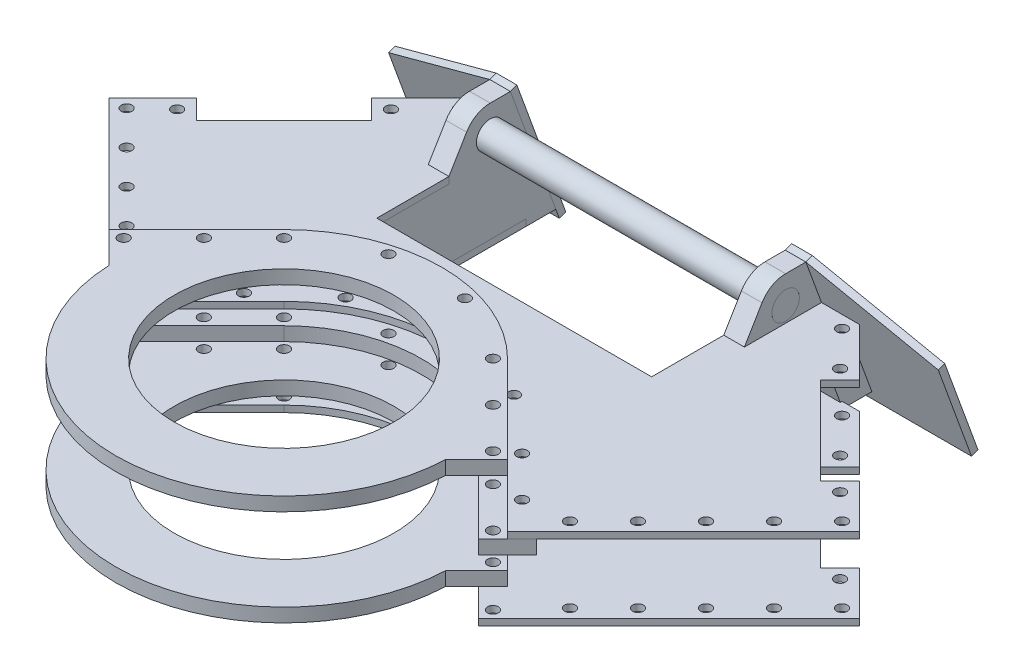
from build123d import *

# Parameters (mm, degrees)
BOSS_EXTRUDE1_DEPTH = 3.0226
SKETCH6_R           = 77.7875
SKETCH6_R_2         = 50.8
BOSS_EXTRUDE2_DEPTH = 6.35
BOSS_EXTRUDE3_DEPTH = 6.35
CUT_EXTRUDE1_DEPTH  = 248.561352176
BOSS_EXTRUDE4_DEPTH = 6.35
CUT_EXTRUDE2_DEPTH  = 250.455207529
SKETCH13_R          = 2.4892
CUT_EXTRUDE3_DEPTH  = 256.391228767
SKETCH14_R          = 2.0193
CUT_EXTRUDE4_DEPTH  = 250.455207529
SKETCH15_R          = 2.4892
CUT_EXTRUDE5_DEPTH  = 250.455207529
SKETCH16_R          = 2.4892
CUT_EXTRUDE6_DEPTH  = 250.455207529
SKETCH19_W          = 9.525
SKETCH19_H          = 35.628833217
CUT_EXTRUDE7_DEPTH  = 250.455207529
MIRROR4_START       = -6.35
MIRROR4_OUTLINE_W   = 9.525
MIRROR4_OUTLINE_H   = 35.628833217
MIRROR4_OUTLINE_R   = 2.4892
MIRROR4_DEPTH       = 3.0226
MIRROR4_START_2     = -41.1226
MIRROR4_2_OUTLINE_R = 2.4892
MIRROR4_2_DEPTH     = 3.0226
SKETCH20_R          = 6.35
BOSS_EXTRUDE5_DEPTH = 9.525
BOSS_EXTRUDE6_DEPTH = 9.525
BOSS_EXTRUDE8_DEPTH = 3.175
SKETCH22_R          = 6.35
BOSS_EXTRUDE7_DEPTH = 146.05


# Read off the part's stored shape, not the designer's step: Mirror4
with BuildPart() as part:
    # Sketch3 → Boss-Extrude1 (new body)
    with BuildSketch(Plane(origin=(0, -38.1, 0), x_dir=(1, 0, 0), z_dir=(0, 1, 0))):
        with BuildLine():
            Line((85.31243315, 4.490128061), (173.375960454, 92.553655364))
            Line((173.375960454, 92.553655364), (153.170384182, 112.759231637))
            Line((153.170384182, 112.759231637), (144.190128061, 103.778975516))
            Line((144.190128061, 103.778975516), (103.778975516, 144.190128061))
            Line((103.778975516, 144.190128061), (112.759231637, 153.170384182))
            Line((112.759231637, 153.170384182), (90.600782602, 175.328833217))
            Line((90.600782602, 175.328833217), (63.5, 175.328833217))
            Line((63.5, 175.328833217), (63.5, 106.3625))
            Line((63.5, 106.3625), (-63.5, 106.3625))
            Line((-63.5, 106.3625), (-63.5, 175.328833217))
            Line((-63.5, 175.328833217), (-90.600782602, 175.328833217))
            Line((-90.600782602, 175.328833217), (-112.759231637, 153.170384182))
            Line((-112.759231637, 153.170384182), (-103.778975516, 144.190128061))
            Line((-103.778975516, 144.190128061), (-144.190128061, 103.778975516))
            Line((-144.190128061, 103.778975516), (-153.170384182, 112.759231637))
            Line((-153.170384182, 112.759231637), (-173.375960454, 92.553655364))
            Line((-173.375960454, 92.553655364), (-85.31243315, 4.490128061))
            Line((-85.31243315, 4.490128061), (-44.901280605, 44.901280605))
            ThreePointArc((-44.901280605, 44.901280605), (0, 63.5), (44.901280605, 44.901280605))
            Line((44.901280605, 44.901280605), (85.31243315, 4.490128061))
        make_face()
    extrude(amount=-BOSS_EXTRUDE1_DEPTH)


with BuildPart() as body_2:
    # Sketch6 → Boss-Extrude2 (new body)
    with BuildSketch(Plane(origin=(0, -25.4, 0), x_dir=(1, 0, 0), z_dir=(0, 1, 0))):
        with Locations(Location((0, 0, 0), (0, 0, 270))):
            Circle(SKETCH6_R)
        with Locations(Location((0, 0, 0), (0, 0, 270))):
            Circle(SKETCH6_R_2, mode=Mode.SUBTRACT)
    extrude(amount=BOSS_EXTRUDE2_DEPTH)

    # Sketch8 → Boss-Extrude3 (add)
    with BuildSketch(Plane(origin=(0, -19.05, 0), x_dir=(1, 0, 0), z_dir=(0, 1, 0))):
        Polygon((-77.725845738, -3.096459351), (-92.047625241, 11.225320151), (-70.586994209, 32.685951183), align=None)
        Polygon((92.047625241, 11.225320151), (70.586994209, 32.685951183), (77.725845738, -3.096459351), align=None)
    extrude(amount=-BOSS_EXTRUDE3_DEPTH)

    # Sketch10 → Cut-Extrude1 (cut, through all)
    with BuildSketch(Plane(origin=(0, -19.05, 0), x_dir=(1, 0, 0), z_dir=(0, 1, 0))):
        with BuildLine():
            Line((-70.586994209, 32.685951183), (-51.636472696, 51.636472696))
            ThreePointArc((-51.636472696, 51.636472696), (0, 73.025), (51.636472696, 51.636472696))
            Line((51.636472696, 51.636472696), (70.586994209, 32.685951183))
            ThreePointArc((70.586994209, 32.685951183), (0, 77.7875), (-70.586994209, 32.685951183))
        make_face()
    extrude(amount=-CUT_EXTRUDE1_DEPTH, mode=Mode.SUBTRACT)


with BuildPart() as body_3:
    # Mirror2: mirrored copy
    add(body_2.part.mirror(Plane.ZX))


with BuildPart() as body_4:
    # Mirror3: mirrored copy
    add(part.part.mirror(Plane.ZX.offset(-22.225)))

    # Sketch12 → Cut-Extrude2 (cut, through all)
    with BuildSketch(Plane(origin=(0, -3.3274, 0), x_dir=(1, 0, 0), z_dir=(0, 1, 0))):
        with BuildLine():
            Line((-51.636472696, 51.636472696), (-92.047625241, 11.225320151))
            Line((-92.047625241, 11.225320151), (-77.725845738, -3.096459351))
            ThreePointArc((-77.725845738, -3.096459351), (0, -77.7875), (77.725845738, -3.096459351))
            Line((77.725845738, -3.096459351), (92.047625241, 11.225320151))
            Line((92.047625241, 11.225320151), (51.636472696, 51.636472696))
            ThreePointArc((51.636472696, 51.636472696), (0, 73.025), (-51.636472696, 51.636472696))
        make_face()
    extrude(amount=-CUT_EXTRUDE2_DEPTH, mode=Mode.SUBTRACT)


with BuildPart() as body_5:
    # Sketch11 → Boss-Extrude4 (new body)
    with BuildSketch(Plane.XZ.offset(6.35)):
        with BuildLine():
            Line((44.901280605, -44.901280605), (85.31243315, -4.490128061))
            Line((85.31243315, -4.490128061), (98.782817332, -17.960512242))
            Line((98.782817332, -17.960512242), (58.371664787, -58.371664787))
            ThreePointArc((58.371664787, -58.371664787), (0, -82.55), (-58.371664787, -58.371664787))
            Line((-58.371664787, -58.371664787), (-98.782817332, -17.960512242))
            Line((-98.782817332, -17.960512242), (-85.31243315, -4.490128061))
            Line((-85.31243315, -4.490128061), (-44.901280605, -44.901280605))
            ThreePointArc((-44.901280605, -44.901280605), (0, -63.5), (44.901280605, -44.901280605))
        make_face()
    extrude(amount=BOSS_EXTRUDE4_DEPTH)


with BuildPart() as cut_extrude3_tool:
    # Sketch13 → Cut-Extrude3 (new, through all)
    with BuildSketch(Plane(origin=(0, 25.4, 0), x_dir=(1, 0, 0), z_dir=(0, 1, 0))):
        with Locations(Location((85.31243315, 11.225320151, 0), (0, 0, 90))):
            Circle(SKETCH13_R)
        with Locations(Location((48.268876651, 48.268876651, 0), (0, 0, 90))):
            Circle(SKETCH13_R)
        with Locations(Location((17.667635066, 65.936511717, 0), (0, 0, 90))):
            Circle(SKETCH13_R)
        with Locations(Location((66.7906549, 29.747098401, 0), (0, 0, 90))):
            Circle(SKETCH13_R)
        with Locations(Location((-85.31243315, 11.225320151, 0), (0, 0, 90))):
            Circle(SKETCH13_R)
        with Locations(Location((-66.7906549, 29.747098401, 0), (0, 0, 90))):
            Circle(SKETCH13_R)
        with Locations(Location((-48.268876651, 48.268876651, 0), (0, 0, 90))):
            Circle(SKETCH13_R)
        with Locations(Location((-17.667635066, 65.936511717, 0), (0, 0, 90))):
            Circle(SKETCH13_R)
    extrude(amount=-CUT_EXTRUDE3_DEPTH)


with BuildPart() as part_1:
    add(part.part)

    # Cut-Extrude3: cut by cut_extrude3_tool
    add(cut_extrude3_tool.part, mode=Mode.SUBTRACT)


with BuildPart() as body_2_1:
    add(body_2.part)

    # Cut-Extrude3: cut by cut_extrude3_tool
    add(cut_extrude3_tool.part, mode=Mode.SUBTRACT)


with BuildPart() as body_3_1:
    add(body_3.part)

    # Cut-Extrude3: cut by cut_extrude3_tool
    add(cut_extrude3_tool.part, mode=Mode.SUBTRACT)


with BuildPart() as body_5_1:
    add(body_5.part)

    # Cut-Extrude3: cut by cut_extrude3_tool
    add(cut_extrude3_tool.part, mode=Mode.SUBTRACT)


with BuildPart() as cut_extrude4_tool:
    # Sketch14 → Cut-Extrude4 (new, through all)
    with BuildSketch(Plane(origin=(0, -3.3274, 0), x_dir=(1, 0, 0), z_dir=(0, 1, 0))):
        with Locations(Location((-82.786736116, 27.221401367, 0), (0, 0, 90))):
            Circle(SKETCH14_R)
        with Locations(Location((-38.89375, 67.365951097, 0), (0, 0, 90))):
            Circle(SKETCH14_R)
        with Locations(Location((-64.264957866, 45.743179617, 0), (0, 0, 90))):
            Circle(SKETCH14_R)
        with Locations(Location((0, 77.7875, 0), (0, 0, 90))):
            Circle(SKETCH14_R)
        with Locations(Location((38.89375, 67.365951097, 0), (0, 0, 90))):
            Circle(SKETCH14_R)
        with Locations(Location((64.264957866, 45.743179617, 0), (0, 0, 90))):
            Circle(SKETCH14_R)
        with Locations(Location((82.786736116, 27.221401367, 0), (0, 0, 90))):
            Circle(SKETCH14_R)
    extrude(amount=-CUT_EXTRUDE4_DEPTH)


with BuildPart() as body_4_1:
    add(body_4.part)

    # Cut-Extrude4: cut by cut_extrude4_tool
    add(cut_extrude4_tool.part, mode=Mode.SUBTRACT)

    # Sketch15 → Cut-Extrude5 (cut, through all)
    with BuildSketch(Plane(origin=(0, -3.3274, 0), x_dir=(1, 0, 0), z_dir=(0, 1, 0))):
        with Locations(Location((-82.786736116, 27.221401367, 0), (0, 0, 270))):
            Circle(SKETCH15_R)
        with Locations(Location((-64.264957866, 45.743179617, 0), (0, 0, 270))):
            Circle(SKETCH15_R)
        with Locations(Location((-38.89375, 67.365951097, 0), (0, 0, 270))):
            Circle(SKETCH15_R)
        with Locations(Location((0, 77.7875, 0), (0, 0, 270))):
            Circle(SKETCH15_R)
        with Locations(Location((38.89375, 67.365951097, 0), (0, 0, 270))):
            Circle(SKETCH15_R)
        with Locations(Location((64.264957866, 45.743179617, 0), (0, 0, 270))):
            Circle(SKETCH15_R)
        with Locations(Location((82.786736116, 27.221401367, 0), (0, 0, 270))):
            Circle(SKETCH15_R)
    extrude(amount=-CUT_EXTRUDE5_DEPTH, mode=Mode.SUBTRACT)


with BuildPart() as body_5_2:
    add(body_5_1.part)

    # Cut-Extrude4: cut by cut_extrude4_tool
    add(cut_extrude4_tool.part, mode=Mode.SUBTRACT)


with BuildPart() as cut_extrude6_tool:
    # Sketch16 → Cut-Extrude6 (new, through all)
    with BuildSketch(Plane(origin=(0, -3.3274, 0), x_dir=(1, 0, 0), z_dir=(0, 1, 0))):
        with Locations(Location((102.431937098, 29.691862517, 0), (0, 0, 270))):
            Circle(SKETCH16_R)
        with Locations(Location((118.147385309, 45.407310729, 0), (0, 0, 270))):
            Circle(SKETCH16_R)
        with Locations(Location((133.862833521, 61.122758941, 0), (0, 0, 270))):
            Circle(SKETCH16_R)
        with Locations(Location((149.578281733, 76.838207153, 0), (0, 0, 270))):
            Circle(SKETCH16_R)
        with Locations(Location((165.293729945, 92.553655364, 0), (0, 0, 270))):
            Circle(SKETCH16_R)
        with Locations(Location((153.170384182, 103.778975516, 0), (0, 0, 270))):
            Circle(SKETCH16_R)
        with Locations(Location((103.778975516, 153.170384182, 0), (0, 0, 270))):
            Circle(SKETCH16_R)
        with Locations(Location((88.233552093, 169.613833217, 0), (0, 0, 270))):
            Circle(SKETCH16_R)
    extrude(amount=-CUT_EXTRUDE6_DEPTH)


with BuildPart() as part_2:
    add(part_1.part)

    # Cut-Extrude6: cut by cut_extrude6_tool
    add(cut_extrude6_tool.part, mode=Mode.SUBTRACT)

    # Mirror4 2 outline → Mirror4 2 (cut)
    with BuildSketch(Plane(origin=(0, 0, 0), x_dir=(1, 0, 0), z_dir=(0, 1, 0)).offset(MIRROR4_START_2)):
        with Locations((-102.431937098, 29.691862517)):
            Circle(MIRROR4_2_OUTLINE_R)
        with Locations((-88.233552093, 169.613833217)):
            Circle(MIRROR4_2_OUTLINE_R)
        with Locations((-103.778975516, 153.170384182)):
            Circle(MIRROR4_2_OUTLINE_R)
        with Locations((-165.293729945, 92.553655364)):
            Circle(MIRROR4_2_OUTLINE_R)
        with Locations((-149.578281733, 76.838207153)):
            Circle(MIRROR4_2_OUTLINE_R)
        with Locations((-133.862833521, 61.122758941)):
            Circle(MIRROR4_2_OUTLINE_R)
        with Locations((-118.147385309, 45.407310729)):
            Circle(MIRROR4_2_OUTLINE_R)
        with Locations((-153.170384182, 103.778975516)):
            Circle(MIRROR4_2_OUTLINE_R)
    extrude(amount=MIRROR4_2_DEPTH, mode=Mode.SUBTRACT)


with BuildPart() as body_4_2:
    add(body_4_1.part)

    # Cut-Extrude6: cut by cut_extrude6_tool
    add(cut_extrude6_tool.part, mode=Mode.SUBTRACT)

    # Sketch19 → Cut-Extrude7 (cut, through all)
    with BuildSketch(Plane(origin=(0, -3.3274, 0), x_dir=(1, 0, 0), z_dir=(0, 1, 0))):
        with Locations((68.2625, 157.514416609)):
            Rectangle(SKETCH19_W, SKETCH19_H)
    extrude(amount=-CUT_EXTRUDE7_DEPTH, mode=Mode.SUBTRACT)

    # Mirror4 outline → Mirror4 (cut)
    with BuildSketch(Plane(origin=(0, 0, 0), x_dir=(1, 0, 0), z_dir=(0, 1, 0)).offset(MIRROR4_START)):
        with Locations((-68.2625, 157.514416609)):
            Rectangle(MIRROR4_OUTLINE_W, MIRROR4_OUTLINE_H)
        with Locations((-102.431937098, 29.691862517)):
            Circle(MIRROR4_OUTLINE_R)
        with Locations((-88.233552093, 169.613833217)):
            Circle(MIRROR4_OUTLINE_R)
        with Locations((-103.778975516, 153.170384182)):
            Circle(MIRROR4_OUTLINE_R)
        with Locations((-165.293729945, 92.553655364)):
            Circle(MIRROR4_OUTLINE_R)
        with Locations((-149.578281733, 76.838207153)):
            Circle(MIRROR4_OUTLINE_R)
        with Locations((-133.862833521, 61.122758941)):
            Circle(MIRROR4_OUTLINE_R)
        with Locations((-118.147385309, 45.407310729)):
            Circle(MIRROR4_OUTLINE_R)
        with Locations((-153.170384182, 103.778975516)):
            Circle(MIRROR4_OUTLINE_R)
    extrude(amount=MIRROR4_DEPTH, mode=Mode.SUBTRACT)


with BuildPart() as body_6:
    # Sketch20 → Boss-Extrude5 (new body)
    with BuildSketch(Plane.ZY.offset(-63.5)):
        with BuildLine():
            Line((-175.328833217, -41.1226), (-175.328833217, -38.1))
            Line((-175.328833217, -38.1), (-106.3625, -38.1))
            Line((-106.3625, -38.1), (-106.3625, -6.35))
            Line((-106.3625, -6.35), (-139.7, -6.35))
            Line((-139.7, -6.35), (-139.7, -3.3274))
            Line((-139.7, -3.3274), (-147.844702607, 10.318800871))
            ThreePointArc((-147.844702607, 10.318800871), (-152.479903153, 14.854269352), (-158.75, 16.51))
            Line((-158.75, 16.51), (-168.108610092, 16.51))
            Line((-168.108610092, 16.51), (-189.085161015, -41.1226))
            Line((-189.085161015, -41.1226), (-175.328833217, -41.1226))
        make_face()
        with Locations((-158.75, 3.81)):
            Circle(SKETCH20_R, mode=Mode.SUBTRACT)
    extrude(amount=-BOSS_EXTRUDE5_DEPTH)


with BuildPart() as body_7:
    # Sketch21 → Boss-Extrude6 (new body)
    with BuildSketch(Plane(origin=(73.025, 0, 0), x_dir=(0, 0, -1), z_dir=(1, 0, 0))):
        Polygon((175.328833217, -38.1), (175.328833217, -41.1226), (189.085161015, -41.1226), (176.428969647, -6.35), (162.913911936, -6.35), (174.469966874, -38.1), align=None)
    extrude(amount=BOSS_EXTRUDE6_DEPTH)


with BuildPart() as body_8:
    # Sketch23 → Boss-Extrude8 (new body)
    with BuildSketch(Plane(origin=(0, 55.960368946, -153.749850064), x_dir=(-1, 0, 0), z_dir=(0, 0.34202014332567326, -0.9396926207859068))):
        Polygon((-73.025, -41.982205749), (-63.5, -41.982205749), (-63.5, -108.010088253), (-127, -108.010088253), (-127, -63.092725892), align=None)
    extrude(amount=BOSS_EXTRUDE8_DEPTH)


with BuildPart() as body_9:
    # Mirror5: mirrored copy
    add(body_6.part.mirror(Plane(origin=(0, 0, 0), x_dir=(0, 0, 1), z_dir=(1, 0, 0))))


with BuildPart() as body_10:
    # Mirror5 2: mirrored copy
    add(body_7.part.mirror(Plane(origin=(0, 0, 0), x_dir=(0, 0, 1), z_dir=(1, 0, 0))))


with BuildPart() as body_11:
    # Mirror5 3: mirrored copy
    add(body_8.part.mirror(Plane(origin=(0, 0, 0), x_dir=(0, 0, 1), z_dir=(1, 0, 0))))


with BuildPart() as body_12:
    # Sketch22 → Boss-Extrude7 (new body)
    with BuildSketch(Plane(origin=(73.025, 0, 0), x_dir=(0, 0, -1), z_dir=(1, 0, 0))):
        with Locations((158.75, 3.81)):
            Circle(SKETCH22_R)
    extrude(amount=-BOSS_EXTRUDE7_DEPTH)


solid = Compound([body_2_1.part, body_3_1.part, body_5_2.part, part_2.part, body_4_2.part, body_6.part, body_7.part, body_8.part, body_9.part, body_10.part, body_11.part, body_12.part])
